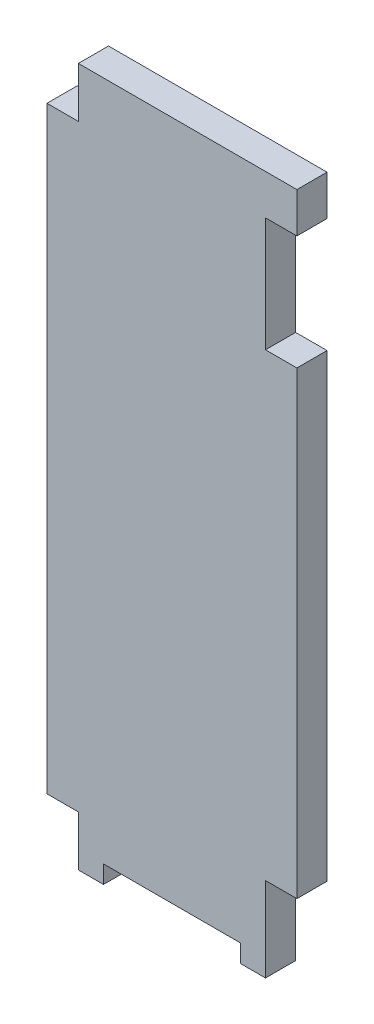
from build123d import *

# Parameters (mm, degrees)
BOSS_EXTRUDE1_DEPTH = 3.048


with BuildPart() as part:
    # Sketch1 → Boss-Extrude1 (new body)
    with BuildSketch(Plane.XY):
        Polygon((0, 6.731), (-3.175, 6.731), (-3.175, -1.8034), (-5.715, -1.8034), (-5.715, 0), (-19.558, 0), (-19.558, -1.8034), (-22.098, -1.8034), (-22.098, 3.2766), (-25.273, 3.2766), (-25.273, 63.754), (-22.098, 63.754), (-22.098, 68.834), (0, 68.834), (0, 64.77), (-3.175, 64.77), (-3.175, 53.213), (0, 53.213), align=None)
    extrude(amount=BOSS_EXTRUDE1_DEPTH)


solid = part.part
